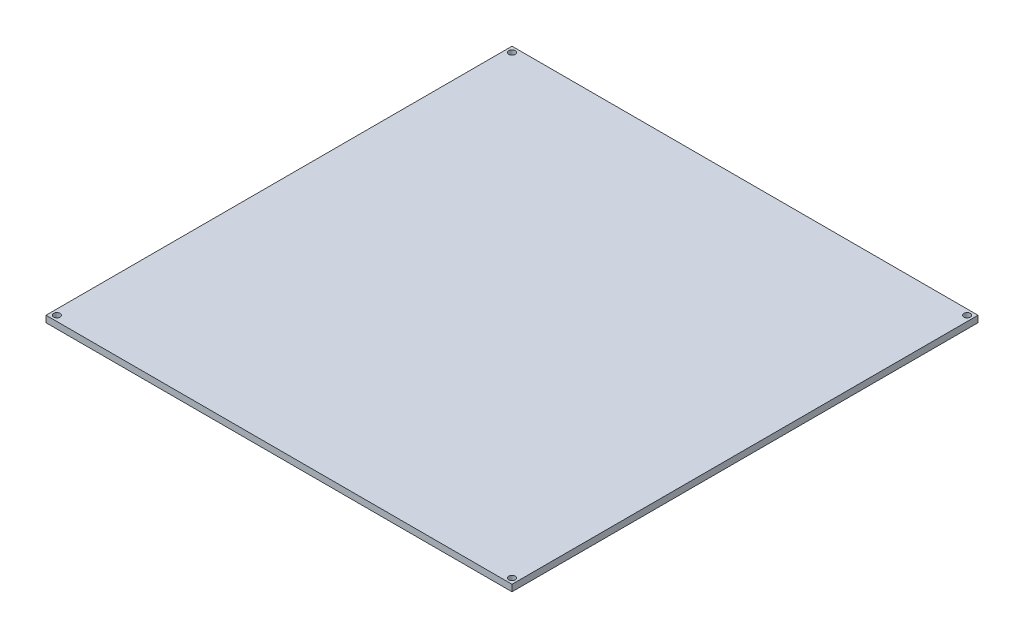
from build123d import *

# Parameters (mm, degrees)
SKETCH1_W           = 214
SKETCH1_H           = 214
SKETCH1_R           = 1.5
BOSS_EXTRUDE1_DEPTH = 3


with BuildPart() as part:
    # Sketch1 → Boss-Extrude1 (new body)
    with BuildSketch(Plane(origin=(0, 0, 0), x_dir=(1, 0, 0), z_dir=(0, 1, 0))):
        Rectangle(SKETCH1_W, SKETCH1_H)
        with Locations((104.5, 104.5)):
            Circle(SKETCH1_R, mode=Mode.SUBTRACT)
        with Locations((-104.5, -104.5)):
            Circle(SKETCH1_R, mode=Mode.SUBTRACT)
        with Locations((104.5, -104.5)):
            Circle(SKETCH1_R, mode=Mode.SUBTRACT)
        with Locations((-104.5, 104.5)):
            Circle(SKETCH1_R, mode=Mode.SUBTRACT)
    extrude(amount=-BOSS_EXTRUDE1_DEPTH)


solid = part.part
